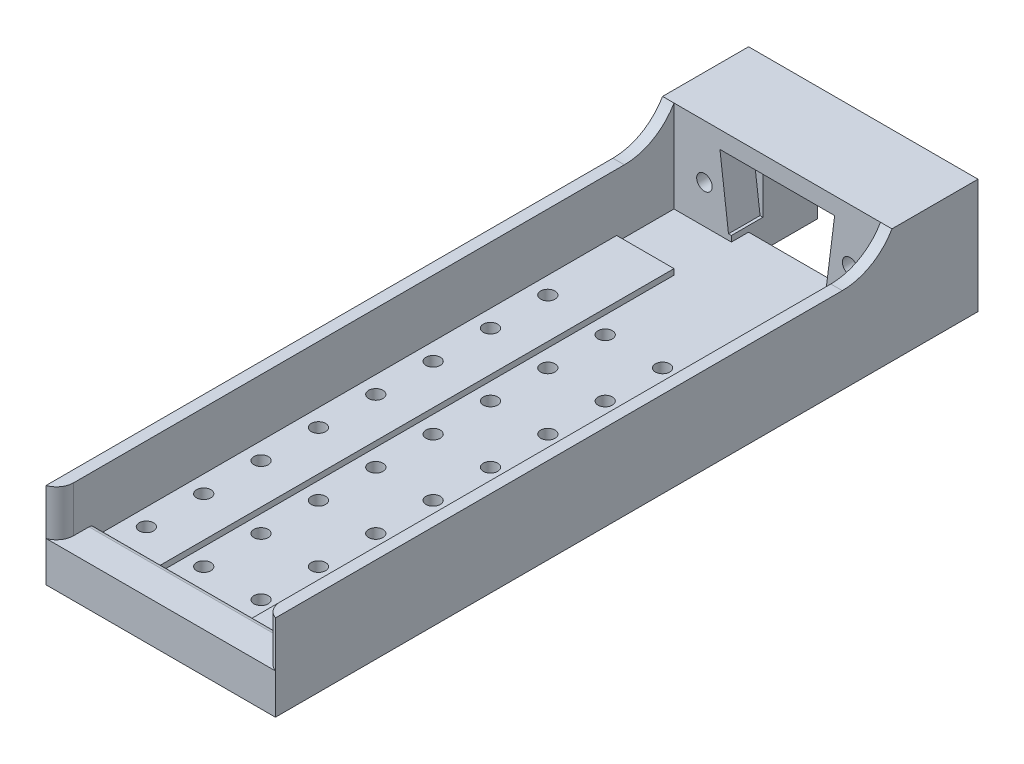
from build123d import *

# Parameters (mm, degrees)
MAIN_DEPTH                      = 61.25
FRONT_CONGE_R                   = 3
ESQUISSE11_W                    = 2
ESQUISSE11_H                    = 15
DSUB_EXTRUSION_ATTACHMENT_DEPTH = 15
ESQUISSE12_W                    = 40
ESQUISSE12_H                    = 15
ESQUISSE12_R                    = 1.35
ESQUISSE12_W_2                  = 16
ESQUISSE12_H_2                  = 7
DSUB_EXTRUSION_DEPTH            = 15
DSUB_FRONT_HOLE_DEPTH           = 5.5
ESQUISSE14_R                    = 4.3
BOTTOM_HOLE_DEPTH               = 2
SKETCH7_W                       = 36
SKETCH7_H                       = 10
DSUBBOTTOMHOLE_DEPTH            = 1
CONG_4_R                        = 10
BOTTOMSTOP_REACH                = 77.839
SKETCH4_W                       = 6.5
SKETCH4_H                       = 7
FILLET1_R                       = 1
SKETCH5_W                       = 16
SKETCH5_H                       = 12
CUT_EXTRUDE1_DEPTH              = 14.175
SKETCH6_R                       = 1.25
FIXHOLE_DEPTH                   = 68.465268843
LPATTERN1_COUNT                 = 8
LPATTERN1_PITCH                 = 10
LPATTERN1_COUNT_DIR2            = 4
LPATTERN1_PITCH_DIR2            = 10


with BuildPart() as part:
    # Esquisse1 → Main (new, symmetric)
    with BuildSketch(Plane.XY):
        Polygon((18, 15), (20, 15), (20, 0), (-20, 0), (-20, 15), (-18, 15), (-18, 5), (-8, 5), (-8, 4), (8, 4), (8, 5), (18, 5), align=None)
    extrude(amount=MAIN_DEPTH, both=True)

    # Front Conge
    # the kernel refuses this fillet: 3 mm, written as the material it takes off along each edge
    with BuildSketch(Plane(origin=(18, 5, 61.25), x_dir=(1, 0, 0), z_dir=(0, 1, 0)), Plane(origin=(-18, 22.071067812, 61.25), x_dir=(-1, 0, 0), z_dir=(0, -1, 0))) as front_conge_piece_1:
        with BuildLine():
            CenterArc((3, 2.828427125), FRONT_CONGE_R, 180, 70.528779366)
            Line((0, 2.828427125), (-0.06, 2.828427125))
            Line((-0.06, 2.828427125), (-0.06, 0))
            Line((-0.06, 0), (0, -0.06))
            ThreePointArc((0, -0.06), (1, -0.06), (1.98, -0.056568542))
            Line((1.98, -0.056568542), (2, 0))
        make_face()
    extrude(amount=17.071067812, mode=Mode.SUBTRACT)

    # Esquisse11 → DSub-Extrusion Attachment (add)
    with BuildSketch(Plane(origin=(0, 0, -46.25), x_dir=(-1, 0, 0), z_dir=(0, 0, -1))):
        with Locations((-19, 12.5)):
            Rectangle(ESQUISSE11_W, ESQUISSE11_H)
        with Locations((19, 12.5)):
            Rectangle(ESQUISSE11_W, ESQUISSE11_H)
    extrude(amount=DSUB_EXTRUSION_ATTACHMENT_DEPTH)

    # Esquisse12 → DSub-Extrusion (add)
    with BuildSketch(Plane(origin=(0, 0, -46.25), x_dir=(-1, 0, 0), z_dir=(0, 0, -1))):
        with Locations((0, 12.5)):
            Rectangle(ESQUISSE12_W, ESQUISSE12_H)
        with Locations((-12.7, 10.675)):
            Circle(ESQUISSE12_R, mode=Mode.SUBTRACT)
        with Locations((12.7, 10.675)):
            Circle(ESQUISSE12_R, mode=Mode.SUBTRACT)
        with Locations((0, 10.675)):
            Rectangle(ESQUISSE12_W_2, ESQUISSE12_H_2, mode=Mode.SUBTRACT)
    extrude(amount=DSUB_EXTRUSION_DEPTH)

    # Esquisse13 → DSub-Front Hole (cut)
    with BuildSketch(Plane.XY.offset(-46.25)):
        Polygon((-10, 17), (10, 17), (8.5, 5), (-8.5, 5), align=None)
    extrude(amount=-DSUB_FRONT_HOLE_DEPTH, mode=Mode.SUBTRACT)

    # Esquisse14 → Bottom Hole (cut)
    with BuildSketch(Plane(origin=(0, 0, -61.25), x_dir=(-1, 0, 0), z_dir=(0, 0, -1))):
        with Locations((-12.7, 10.675)):
            Circle(ESQUISSE14_R)
        with Locations((12.7, 10.675)):
            Circle(ESQUISSE14_R)
    extrude(amount=-BOTTOM_HOLE_DEPTH, mode=Mode.SUBTRACT)

    # Sketch7 → DSubBottomHole (cut)
    with BuildSketch(Plane(origin=(0, 5, 0), x_dir=(1, 0, 0), z_dir=(0, 1, 0))):
        with Locations((0, 41.25)):
            Rectangle(SKETCH7_W, SKETCH7_H)
    extrude(amount=-DSUBBOTTOMHOLE_DEPTH, mode=Mode.SUBTRACT)

    # Congé4
    # the kernel refuses this fillet: 10 mm, written as the material it adds along each edge
    with BuildSketch(Plane(origin=(-18, 15, -46.25), x_dir=(0, 1, 0), z_dir=(-1, 0, 0)), Plane(origin=(20, 15, -46.25), x_dir=(0, 1, 0), z_dir=(-1, 0, 0))) as cong_4_piece_1:
        with BuildLine():
            CenterArc((10, -8.660254038), CONG_4_R, 120, 60)
            Line((0, -8.660254038), (0, 0))
            Line((0, 0), (5, 0))
        make_face()
    extrude(amount=2)

    # BottomStop: up to this face of the body (flat: up to its plane)
    bottomstop_end = Plane(part.part.faces().sort_by_distance((20, 7.947826544, -2.383218252))[0])
    # Sketch4 → BottomStop (add, up to the picked face)
    with BuildSketch(Plane.ZY.offset(20), mode=Mode.PRIVATE) as bottomstop_sk1:
        with Locations((58, 3.5)):
            Rectangle(SKETCH4_W, SKETCH4_H)
    bottomstop_tool1 = split(extrude(bottomstop_sk1.sketch, amount=-BOTTOMSTOP_REACH, mode=Mode.PRIVATE), bisect_by=bottomstop_end, keep=Keep.BOTH, mode=Mode.PRIVATE)
    add(bottomstop_tool1.solids().sort_by(Axis((-20, 3.5, 58), (1, 0, 0)))[0])

    # Fillet1
    fillet1_edges = [part.edges().sort_by_distance(p)[0] for p in [
        (0, 4, 54.75),
        (0, 7, 54.75),
    ]]
    fillet(fillet1_edges, radius=FILLET1_R)

    # Sketch5 → Cut-Extrude1 (cut)
    with BuildSketch(Plane(origin=(0, 0, 0), x_dir=(-1, 0, 0), z_dir=(0, -1, 0))):
        with Locations((0, 55.25)):
            Rectangle(SKETCH5_W, SKETCH5_H)
    extrude(amount=-CUT_EXTRUDE1_DEPTH, mode=Mode.SUBTRACT)

    # Sketch6 → FixHole (cut, through all)
    with BuildSketch(Plane(origin=(0, 0, 0), x_dir=(-1, 0, 0), z_dir=(0, -1, 0))):
        with Locations(Location((15, -48.75, 0), (0, 0, 180))):
            Circle(SKETCH6_R)
    fixhole = extrude(amount=-FIXHOLE_DEPTH, mode=Mode.SUBTRACT)

    # LPattern1: FixHole 8 × 4
    with Locations(*[(j * LPATTERN1_PITCH_DIR2, 0, -i * LPATTERN1_PITCH) for i in range(LPATTERN1_COUNT) for j in range(LPATTERN1_COUNT_DIR2) if (i, j) != (0, 0)]):
        add(fixhole, mode=Mode.SUBTRACT)


solid = part.part
